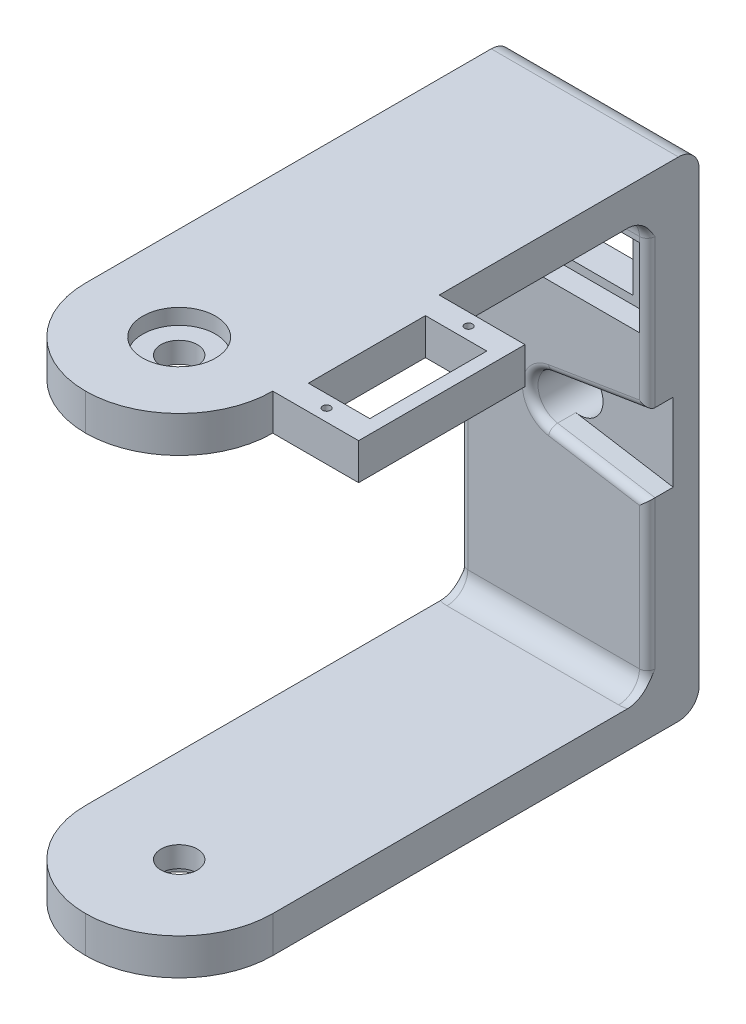
from build123d import *

# Parameters (mm, degrees)
SKETCH1_W               = 94
SKETCH1_H               = 36
BOSS_EXTRUDE1_DEPTH     = 10
SKETCH2_W               = 36
SKETCH2_H               = 7
BOSS_EXTRUDE2_DEPTH     = 90
CUT_EXTRUDE1_DEPTH      = 139.419651784
CUT_EXTRUDE1_DEPTH_BACK = 139.419651784
SKETCH3_R               = 3.5
CUT_EXTRUDE2_DEPTH      = 139.419651784
CUT_EXTRUDE2_DEPTH_BACK = 3
SKETCH4_R               = 7
CUT_EXTRUDE3_START      = -3
SKETCH5_R               = 7
CUT_EXTRUDE3_DEPTH      = 3
FILLET1_R               = 18
SKETCH6_R               = 7.5
BOSS_EXTRUDE3_DEPTH     = 8
SKETCH7_R               = 4.5
CUT_EXTRUDE4_DEPTH      = 120.151164493
FILLET2_R               = 2
SKETCH9_R               = 0.75
SKETCH9_W               = 22.5
SKETCH9_H               = 11.8
CUT_EXTRUDE5_DEPTH      = 104.116439039
SKETCH10_W              = 33
SKETCH10_H              = 15
CUT_EXTRUDE6_DEPTH      = 4
SKETCH11_W              = 17
SKETCH11_H              = 32
BOSS_EXTRUDE4_DEPTH     = 7
CUT_EXTRUDE7_REACH      = 143.515
SKETCH12_R              = 0.75
SKETCH12_W              = 11.8
SKETCH12_H              = 22.5
CUT_EXTRUDE8_START      = -5
CUT_EXTRUDE8_DEPTH      = 5
FILLET3_R               = 1.5
FILLET4_R               = 4


# Some blends are built 0.0001 mm under size
with BuildPart() as part:
    # Sketch1 → Boss-Extrude1 (new body)
    with BuildSketch(Plane(origin=(0, 0, 0), x_dir=(0, 1, 0), z_dir=(0, 0, 1))):
        Rectangle(SKETCH1_W, SKETCH1_H)
    extrude(amount=BOSS_EXTRUDE1_DEPTH)

    # Sketch2 → Boss-Extrude2 (add)
    with BuildSketch(Plane.XY.offset(10)):
        with Locations((0, 43.5)):
            Rectangle(SKETCH2_W, SKETCH2_H)
        with Locations((0, -43.5)):
            Rectangle(SKETCH2_W, SKETCH2_H)
    extrude(amount=BOSS_EXTRUDE2_DEPTH)

    # Sketch3 → Cut-Extrude1 (cut, two sides: drawn at the far end of the back side and taken through both)
    with BuildSketch(Plane.XZ.offset(47).offset(-CUT_EXTRUDE1_DEPTH_BACK)):
        with Locations(Location((0, 82, 0), (0, 0, 270))):
            Circle(SKETCH3_R)
    extrude(amount=CUT_EXTRUDE1_DEPTH + CUT_EXTRUDE1_DEPTH_BACK, mode=Mode.SUBTRACT)

    # Sketch4 → Cut-Extrude2 (cut, two sides: drawn at the far end of the back side and taken through both)
    with BuildSketch(Plane.XZ.offset(47).offset(-CUT_EXTRUDE2_DEPTH_BACK)):
        with Locations(Location((0, 82, 0), (0, 0, 90))):
            Circle(SKETCH4_R)
    extrude(amount=CUT_EXTRUDE2_DEPTH + CUT_EXTRUDE2_DEPTH_BACK, mode=Mode.SUBTRACT)

    # Sketch5 → Cut-Extrude3 (cut)
    with BuildSketch(Plane(origin=(0, 47, 0), x_dir=(-1, 0, 0), z_dir=(0, 1, 0)).offset(CUT_EXTRUDE3_START)):
        with Locations(Location((0, 82, 0), (0, 0, 90))):
            Circle(SKETCH5_R)
    extrude(amount=CUT_EXTRUDE3_DEPTH, mode=Mode.SUBTRACT)

    # Fillet1
    fillet1_edges = [part.edges().sort_by_distance(p)[0] for p in [
        (18, -43.5, 100),
        (-18, -43.5, 100),
        (18, 43.5, 100),
        (-18, 43.5, 100),
    ]]
    fillet(fillet1_edges, radius=FILLET1_R - 0.0001)  # a hair under: the kernel refuses the full size

    # Sketch6 → Boss-Extrude3 (add)
    with BuildSketch(Plane(origin=(0, 0, 0), x_dir=(1, 0, 0), z_dir=(0, 0, -1))):
        with Locations(Location((0, 0, 0), (0, 0, 180))):
            Circle(SKETCH6_R)
    extrude(amount=BOSS_EXTRUDE3_DEPTH)

    # Sketch7 → Cut-Extrude4 (cut, through all)
    with BuildSketch(Plane(origin=(0, 0, -8), x_dir=(1, 0, 0), z_dir=(0, 0, -1))):
        with Locations(Location((0, 0, 0), (0, 0, 180))):
            Circle(SKETCH7_R)
    extrude(amount=-CUT_EXTRUDE4_DEPTH, mode=Mode.SUBTRACT)

    # Fillet2
    fillet2_edges = [part.edges().sort_by_distance(p)[0] for p in [
        (7.5, 0, 0),
    ]]
    fillet(fillet2_edges, radius=FILLET2_R)

    # Sketch9 → Cut-Extrude5 (cut, through all)
    with BuildSketch(Plane.XY.offset(10)):
        with Locations((-13.65, 27.484131785)):
            Circle(SKETCH9_R)
        with Locations((13.65, 27.484131785)):
            Circle(SKETCH9_R)
        with Locations((0, 27.484131785)):
            Rectangle(SKETCH9_W, SKETCH9_H)
    extrude(amount=-CUT_EXTRUDE5_DEPTH, mode=Mode.SUBTRACT)

    # Sketch10 → Cut-Extrude6 (cut)
    with BuildSketch(Plane.XY.offset(10)):
        with Locations((0, 27.484131785)):
            Rectangle(SKETCH10_W, SKETCH10_H)
    extrude(amount=-CUT_EXTRUDE6_DEPTH, mode=Mode.SUBTRACT)

    # Sketch11 → Boss-Extrude4 (add)
    with BuildSketch(Plane(origin=(0, 47, 0), x_dir=(-1, 0, 0), z_dir=(0, 1, 0))):
        with Locations((-26.003605519, 66)):
            Rectangle(SKETCH11_W, SKETCH11_H)
    extrude(amount=-BOSS_EXTRUDE4_DEPTH)

    # Sketch12 → Cut-Extrude7 (cut, up to next)
    with BuildSketch(Plane(origin=(0, 47, 0), x_dir=(-1, 0, 0), z_dir=(0, 1, 0)), mode=Mode.PRIVATE) as cut_extrude7_sk1:
        with Locations(Location((-26.003605519, 79.65, 0), (0, 0, 90))):
            Circle(SKETCH12_R)
    cut_extrude7_tool1 = extrude(cut_extrude7_sk1.sketch, amount=-CUT_EXTRUDE7_REACH, mode=Mode.PRIVATE) & part.part
    # Sketch12 → Cut-Extrude7 (cut, up to next)
    with BuildSketch(Plane(origin=(0, 47, 0), x_dir=(-1, 0, 0), z_dir=(0, 1, 0)), mode=Mode.PRIVATE) as cut_extrude7_sk2:
        with Locations((-26.003605519, 52.35)):
            Circle(SKETCH12_R)
    cut_extrude7_tool2 = extrude(cut_extrude7_sk2.sketch, amount=-CUT_EXTRUDE7_REACH, mode=Mode.PRIVATE) & part.part
    # Sketch12 → Cut-Extrude7 (cut, up to next)
    with BuildSketch(Plane(origin=(0, 47, 0), x_dir=(-1, 0, 0), z_dir=(0, 1, 0)), mode=Mode.PRIVATE) as cut_extrude7_sk3:
        with Locations((-26.003605519, 66)):
            Rectangle(SKETCH12_W, SKETCH12_H)
    cut_extrude7_tool3 = extrude(cut_extrude7_sk3.sketch, amount=-CUT_EXTRUDE7_REACH, mode=Mode.PRIVATE) & part.part
    add(cut_extrude7_tool1.solids().sort_by_distance((26.003606, 47, 79.65))[0], mode=Mode.SUBTRACT)
    add(cut_extrude7_tool2.solids().sort_by_distance((26.003606, 47, 52.35))[0], mode=Mode.SUBTRACT)
    add(cut_extrude7_tool3.solids().sort_by_distance((26.003606, 47, 66))[0], mode=Mode.SUBTRACT)

    # Sketch13 → Cut-Extrude8 (cut)
    with BuildSketch(Plane.XY.offset(10).offset(CUT_EXTRUDE8_START)):
        with BuildLine():
            Line((18, -7.5), (18, 7.5))
            Line((18, 7.5), (-0.72547331, 4.441135944))
            ThreePointArc((-0.72547331, 4.441135944), (4.5, 0), (-0.72547331, -4.441135944))
            Line((-0.72547331, -4.441135944), (18, -7.5))
        make_face()
    extrude(amount=CUT_EXTRUDE8_DEPTH, mode=Mode.SUBTRACT)

    # Fillet3
    fillet3_edges = [part.edges().sort_by_distance(p)[0] for p in [
        (-18, 0, 10),
        (18, -23.75, 10),
        (-3.428894129, 2.914221174, 10),
        (18, 23.75, 10),
        (8.637263345, -5.970567972, 10),
        (8.637263345, 5.970567972, 10),
    ]]
    fillet(fillet3_edges, radius=FILLET3_R - 0.0001)  # a hair under: the kernel refuses the full size

    # Fillet4
    # the kernel refuses this fillet: 4 mm, written as the material it adds along each edge
    with BuildSketch(Plane(origin=(16.5001, 40, 10), x_dir=(0, -1, 0), z_dir=(-1, 0, 0))) as fillet4_piece_1:
        with BuildLine():
            CenterArc((FILLET4_R, FILLET4_R), FILLET4_R, 180, 90)
            Line((0, FILLET4_R), (0, 0))
            Line((0, 0), (FILLET4_R, 0))
        make_face()
    extrude(amount=33.0002)
    with BuildSketch(Plane(origin=(16.5001, -40, 10), x_dir=(0, 1, 0), z_dir=(-1, 0, 0))) as fillet4_piece_2:
        with BuildLine():
            CenterArc((FILLET4_R, -FILLET4_R), FILLET4_R, 90, 90)
            Line((0, -FILLET4_R), (0, 0))
            Line((0, 0), (FILLET4_R, 0))
        make_face()
    extrude(amount=33.0002)
    with BuildSketch(Plane(origin=(-16.5001, -40, 8.5001), x_dir=(0.006283143965556653, 0, 0.9999802608561371), z_dir=(-0.9999802608561371, 0, 0.006283143965556653))) as fillet4_piece_3_section:
        with BuildLine():
            CenterArc((-1.4999 - FILLET4_R, FILLET4_R), FILLET4_R, 270, 90)
            Line((-1.4999 - FILLET4_R, 0), (-1.4999, 0))
            Line((-1.4999, 0), (-1.4999, FILLET4_R))
        make_face()
    fillet4_piece_3 = revolve(axis=Axis((-16.5001, -40, 8.5001), (0, 1, 0)), revolution_arc=359.64, mode=Mode.PRIVATE)
    fillet4_piece_3 = split(fillet4_piece_3, bisect_by=Plane(origin=(-18, -38.511467158, 9.644627934), z_dir=(1, 0, 0)), keep=Keep.TOP, mode=Mode.PRIVATE)
    add(fillet4_piece_3)
    with BuildSketch(Plane(origin=(-16.5001, 40, 8.5001), x_dir=(0.006283143965556653, 0, 0.9999802608561371), z_dir=(-0.9999802608561371, 0, 0.006283143965556653))) as fillet4_piece_4_section:
        with BuildLine():
            CenterArc((-1.4999 - FILLET4_R, -FILLET4_R), FILLET4_R, 0, 90)
            Line((-1.4999 - FILLET4_R, 0), (-1.4999, 0))
            Line((-1.4999, 0), (-1.4999, -FILLET4_R))
        make_face()
    fillet4_piece_4 = revolve(axis=Axis((-16.5001, 40, 8.5001), (0, 1, 0)), revolution_arc=359.64, mode=Mode.PRIVATE)
    fillet4_piece_4 = split(fillet4_piece_4, bisect_by=Plane(origin=(-18, 38.511467158, 9.644627939), z_dir=(1, 0, 0)), keep=Keep.TOP, mode=Mode.PRIVATE)
    add(fillet4_piece_4)
    with BuildSketch(Plane(origin=(16.5001, -40, 8.5001), x_dir=(-0.006283143965559021, 0, 0.9999802608561371), z_dir=(0.9999802608561371, 0, 0.006283143965559021))) as fillet4_piece_5_section:
        with BuildLine():
            CenterArc((-1.4999 - FILLET4_R, -FILLET4_R), FILLET4_R, 0, 90)
            Line((-1.4999 - FILLET4_R, 0), (-1.4999, 0))
            Line((-1.4999, 0), (-1.4999, -FILLET4_R))
        make_face()
    fillet4_piece_5 = revolve(axis=Axis((16.5001, -40, 8.5001), (0, -1, 0)), revolution_arc=359.64, mode=Mode.PRIVATE)
    fillet4_piece_5 = split(fillet4_piece_5, bisect_by=Plane(origin=(18, -38.511467161, 9.644627937), z_dir=(-1, 0, 0)), keep=Keep.TOP, mode=Mode.PRIVATE)
    add(fillet4_piece_5)
    with BuildSketch(Plane(origin=(16.5001, 40, 8.5001), x_dir=(-0.006283143965559021, 0, 0.9999802608561371), z_dir=(0.9999802608561371, 0, 0.006283143965559021))) as fillet4_piece_6_section:
        with BuildLine():
            CenterArc((-1.4999 - FILLET4_R, FILLET4_R), FILLET4_R, 270, 90)
            Line((-1.4999, FILLET4_R), (-1.4999, 0))
            Line((-1.4999, 0), (-1.4999 - FILLET4_R, 0))
        make_face()
    fillet4_piece_6 = revolve(axis=Axis((16.5001, 40, 8.5001), (0, -1, 0)), revolution_arc=359.64, mode=Mode.PRIVATE)
    fillet4_piece_6 = split(fillet4_piece_6, bisect_by=Plane(origin=(18, 38.511467202, 9.644627972), z_dir=(-1, 0, 0)), keep=Keep.TOP, mode=Mode.PRIVATE)
    add(fillet4_piece_6)
    # the kernel refuses this fillet: 4 mm, written as the material it takes off along each edge
    with BuildSketch(Plane(origin=(-28, -47, 0), x_dir=(0, 0, 1), z_dir=(1, 0, 0))) as fillet4_2_piece_1:
        with BuildLine():
            CenterArc((FILLET4_R, -FILLET4_R), FILLET4_R, 90, 90)
            Line((0, -FILLET4_R), (0, 0))
            Line((0, 0), (FILLET4_R, 0))
        make_face()
    extrude(amount=56, mode=Mode.SUBTRACT)
    with BuildSketch(Plane(origin=(28, 47, 0), x_dir=(0, -1, 0), z_dir=(-1, 0, 0))) as fillet4_2_piece_2:
        with BuildLine():
            CenterArc((FILLET4_R, FILLET4_R), FILLET4_R, 180, 90)
            Line((0, FILLET4_R), (0, 0))
            Line((0, 0), (FILLET4_R, 0))
        make_face()
    extrude(amount=56, mode=Mode.SUBTRACT)


solid = part.part
